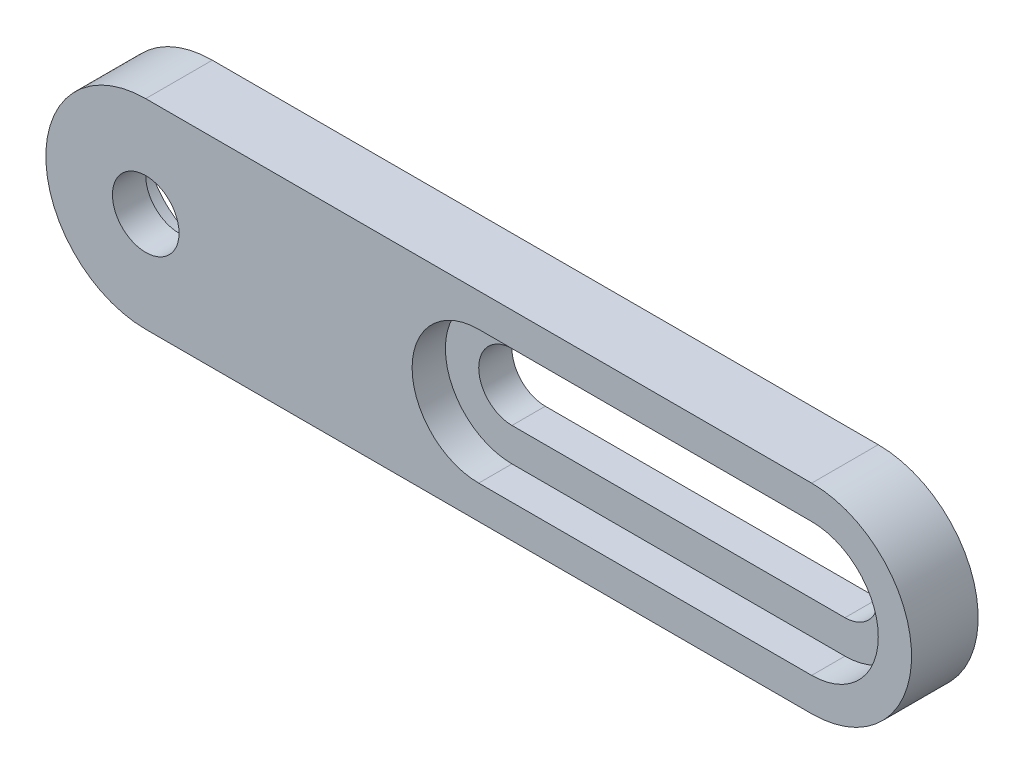
from build123d import *

# Parameters (mm, degrees)
BASE_FLANGE1_DEPTH = 5
SKETCH17_R         = 5
CUT_EXTRUDE1_DEPTH = 2.5
SKETCH39_R         = 2.5
CUT_EXTRUDE2_DEPTH = 10
CUT_EXTRUDE4_DEPTH = 59.202233634
SKETCH40_R         = 5
SKETCH40_R_2       = 2.5
CUT_EXTRUDE6_DEPTH = 2.5


# Sheet-metal steps are written as plain solids
with BuildPart() as part:
    # Sketch1 → Base-Flange1 (new body)
    with BuildSketch(Plane.XY):
        with BuildLine():
            Line((0, 7.5), (50, 7.5))
            ThreePointArc((50, 7.5), (57.5, 0), (50, -7.5))
            Line((50, -7.5), (0, -7.5))
            ThreePointArc((0, -7.5), (-7.5, 0), (0, 7.5))
        make_face()
    extrude(amount=-BASE_FLANGE1_DEPTH)

    # Sketch17 → Cut-Extrude1 (cut)
    with BuildSketch(Plane(origin=(0, 0, -5), x_dir=(-1, 0, 0), z_dir=(0, 0, -1))):
        Circle(SKETCH17_R)
    extrude(amount=-CUT_EXTRUDE1_DEPTH, mode=Mode.SUBTRACT)

    # Sketch39 → Cut-Extrude2 (cut)
    with BuildSketch(Plane.XY):
        Circle(SKETCH39_R)
        with Locations((50, 0)):
            Circle(SKETCH39_R)
    extrude(amount=-CUT_EXTRUDE2_DEPTH, mode=Mode.SUBTRACT)

    # Sketch41 → Cut-Extrude4 (cut, through all)
    with BuildSketch(Plane.XY):
        with BuildLine():
            Line((25, 2.5), (50, 2.5))
            ThreePointArc((50, 2.5), (52.5, 0), (50, -2.5))
            Line((50, -2.5), (25, -2.5))
            ThreePointArc((25, -2.5), (22.5, 0), (25, 2.5))
        make_face()
    extrude(amount=-CUT_EXTRUDE4_DEPTH, mode=Mode.SUBTRACT)

    # Sketch40 → Cut-Extrude6 (cut)
    # profile 1 of 2: a face of its own
    with BuildSketch(Plane.XY):
        with Locations((50, 0)):
            Circle(SKETCH40_R)
        with Locations((50, 0)):
            Circle(SKETCH40_R_2, mode=Mode.SUBTRACT)
    # profile 2 of 2: a face of its own
    with BuildSketch(Plane.XY):
        with BuildLine():
            Line((25, -5), (50, -5))
            ThreePointArc((50, -5), (45, 0), (50, 5))
            Line((50, 5), (25, 5))
            ThreePointArc((25, 5), (20, 0), (25, -5))
        make_face()
    extrude(amount=-CUT_EXTRUDE6_DEPTH, mode=Mode.SUBTRACT)


solid = part.part
